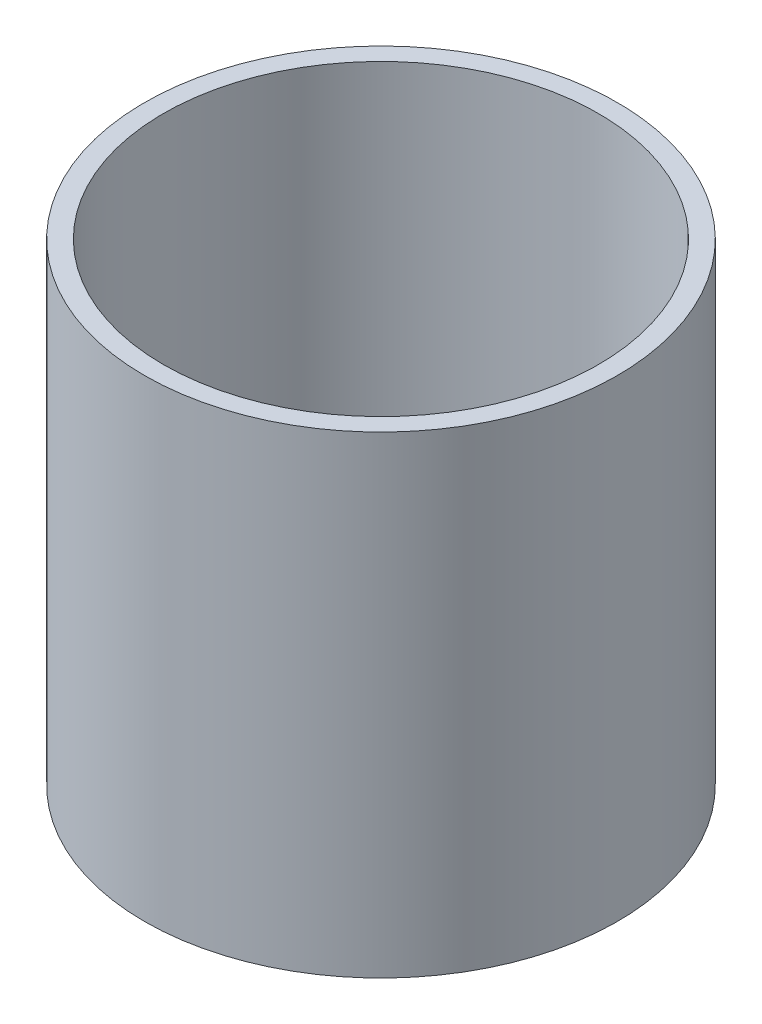
from build123d import *

# Parameters (mm, degrees)
SKETCH1_R           = 1250
SKETCH1_R_2         = 1150
BOSS_EXTRUDE1_DEPTH = 2500


with BuildPart() as part:
    # Sketch1 → Boss-Extrude1 (new body)
    with BuildSketch(Plane(origin=(0, 0, 0), x_dir=(1, 0, 0), z_dir=(0, 1, 0))):
        Circle(SKETCH1_R)
        Circle(SKETCH1_R_2, mode=Mode.SUBTRACT)
    extrude(amount=BOSS_EXTRUDE1_DEPTH)


solid = part.part
